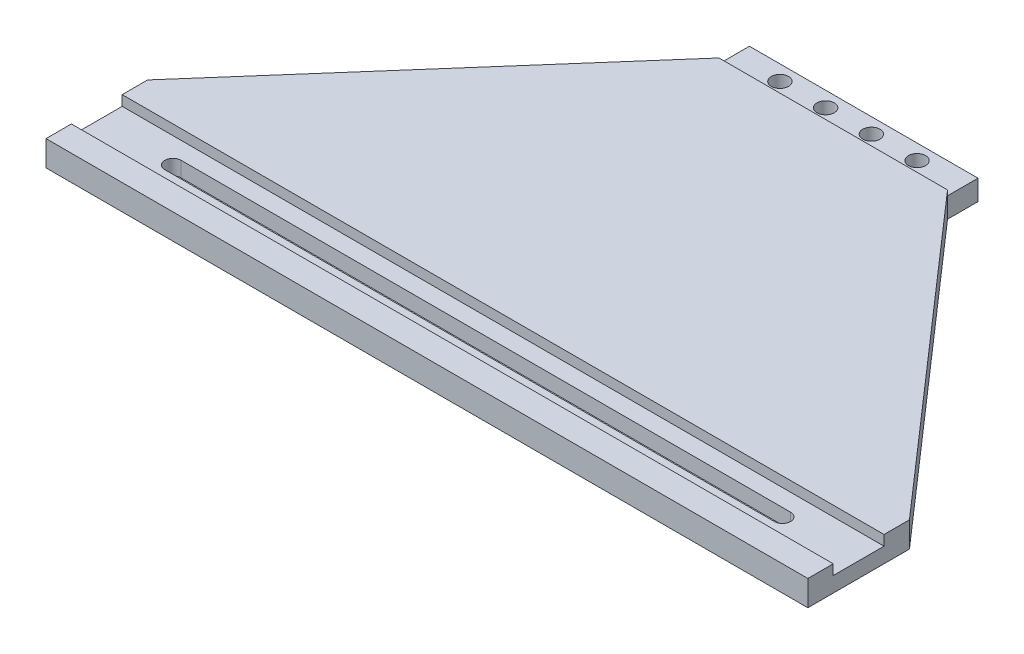
from build123d import *

# Parameters (mm, degrees)
EXTRUDE_1_DEPTH     = 5
SKETCH_2_W          = 150
SKETCH_2_H          = 10
CUT_EXTRUDE_1_DEPTH = 2
SKETCH_3_W          = 45
SKETCH_3_H          = 6
CUT_EXTRUDE_2_DEPTH = 1
HOLE_WIZARD_M31_D   = 3.4
CUT_EXTRUDE_3_DEPTH = 112.90621073


with BuildPart() as part:
    # Эскиз1 → Бобышка-Вытянуть1 (new body)
    with BuildSketch(Plane(origin=(0, 0, 0), x_dir=(1, 0, 0), z_dir=(0, 1, 0))):
        Polygon((-22.5, 3), (22.5, 3), (22.5, -3), (75, -63), (75, -83), (-75, -83), (-75, -63), (-22.5, -3), align=None)
    extrude(amount=EXTRUDE_1_DEPTH)

    # Эскиз2 → Вырез-Вытянуть1 (cut)
    with BuildSketch(Plane(origin=(0, 5, 0), x_dir=(1, 0, 0), z_dir=(0, 1, 0))):
        with Locations((0, -73)):
            Rectangle(SKETCH_2_W, SKETCH_2_H)
    extrude(amount=-CUT_EXTRUDE_1_DEPTH, mode=Mode.SUBTRACT)

    # Эскиз3 → Вырез-Вытянуть2 (cut)
    with BuildSketch(Plane(origin=(0, 5, 0), x_dir=(1, 0, 0), z_dir=(0, 1, 0))):
        Rectangle(SKETCH_3_W, SKETCH_3_H)
    extrude(amount=-CUT_EXTRUDE_2_DEPTH, mode=Mode.SUBTRACT)

    # Отверстие с зазором M31 (through all)
    with Locations(Plane(origin=(0, 0, 0), x_dir=(-1, 0, 0), z_dir=(0, -1, 0))):
        with Locations((-13.5, 0), (-4.5, 0), (4.5, 0), (13.5, 0)):
            Hole(HOLE_WIZARD_M31_D / 2)

    # Эскиз9 → Вырез-Вытянуть3 (cut, through all)
    with BuildSketch(Plane(origin=(0, 3, 0), x_dir=(1, 0, 0), z_dir=(0, 1, 0))):
        with BuildLine():
            Line((-60, -71.4), (60, -71.4))
            ThreePointArc((60, -71.4), (61.6, -73), (60, -74.6))
            Line((60, -74.6), (-60, -74.6))
            ThreePointArc((-60, -74.6), (-61.6, -73), (-60, -71.4))
        make_face()
    extrude(amount=-CUT_EXTRUDE_3_DEPTH, mode=Mode.SUBTRACT)


solid = part.part
